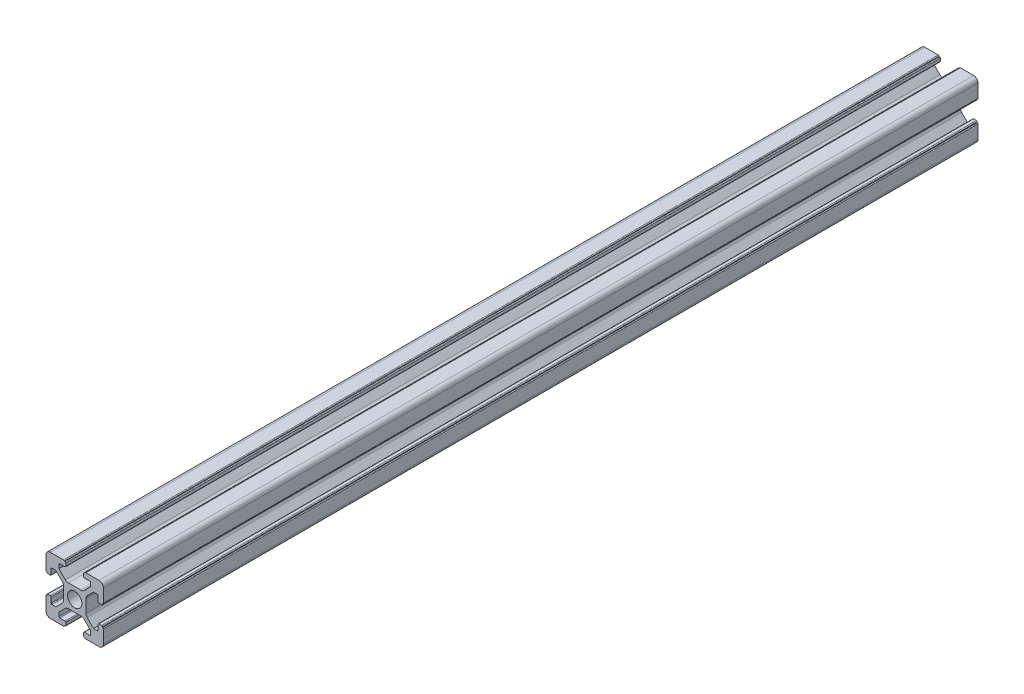
from build123d import *

# Parameters (mm, degrees)
BOSS_EXTRUDE1_DEPTH = 304.8
F_3DSKETCH2_R       = 2.5
CUT_EXTRUDE1_DEPTH  = 306.128019157


with BuildPart() as part:
    # Sketch1 → Boss-Extrude1 (new body)
    with BuildSketch(Plane.XY):
        with BuildLine():
            ThreePointArc((-4.339541497, 3.27832502), (-4.01438237, 2.791689997), (-3.900201668, 2.217664848))
            Line((-3.900201668, 2.217664848), (-3.900201668, -2.220777458))
            ThreePointArc((-3.900201668, -2.220777458), (-4.013982246, -2.793835668), (-4.338062619, -3.279956687))
            ThreePointArc((-4.338062619, -3.279956687), (-4.338801799, -3.280697416), (-4.339541497, -3.28143763))
            Line((-4.339541497, -3.28143763), (-6.559305445, -5.501201578))
            Line((-6.559305445, -5.501201578), (-7.918645273, -5.501201578))
            ThreePointArc((-7.918645273, -5.501201578), (-8.116635172, -5.419191476), (-8.198645273, -5.221201578))
            Line((-8.198645273, -5.221201578), (-8.198645273, -3.381201578))
            ThreePointArc((-8.198645273, -3.381201578), (-8.280655374, -3.183211679), (-8.478645273, -3.101201578))
            Line((-8.478645273, -3.101201578), (-9.418645273, -3.101201578))
            ThreePointArc((-9.418645273, -3.101201578), (-9.616635172, -3.183211679), (-9.698645273, -3.381201578))
            Line((-9.698645273, -3.381201578), (-9.698645273, -3.601201578))
            Line((-9.698645273, -3.601201578), (-9.718645273, -3.601201578))
            ThreePointArc((-9.718645273, -3.601201578), (-9.916635172, -3.683211679), (-9.998645273, -3.881201578))
            Line((-9.998645273, -3.881201578), (-9.998645273, -8.501201578))
            ThreePointArc((-9.998645273, -8.501201578), (-9.559305445, -9.561861749), (-8.498645273, -10.001201578))
            Line((-8.498645273, -10.001201578), (-3.878645273, -10.001201578))
            ThreePointArc((-3.878645273, -10.001201578), (-3.680655374, -9.919191476), (-3.598645273, -9.721201578))
            Line((-3.598645273, -9.721201578), (-3.598645273, -9.701201578))
            Line((-3.598645273, -9.701201578), (-3.378645273, -9.701201578))
            ThreePointArc((-3.378645273, -9.701201578), (-3.180655374, -9.619191476), (-3.098645273, -9.421201578))
            Line((-3.098645273, -9.421201578), (-3.098645273, -8.481201578))
            ThreePointArc((-3.098645273, -8.481201578), (-3.180655374, -8.283211679), (-3.378645273, -8.201201578))
            Line((-3.378645273, -8.201201578), (-5.218645273, -8.201201578))
            ThreePointArc((-5.218645273, -8.201201578), (-5.416635172, -8.119191476), (-5.498645273, -7.921201578))
            Line((-5.498645273, -7.921201578), (-5.498645273, -6.561861749))
            Line((-5.498645273, -6.561861749), (-3.277324929, -4.340541406))
            ThreePointArc((-3.277324929, -4.340541406), (-2.790689906, -4.015382279), (-2.216664757, -3.901201578))
            Line((-2.216664757, -3.901201578), (2.234977304, -3.899793498))
            ThreePointArc((2.234977304, -3.899793498), (2.801097117, -4.016727825), (3.280957809, -4.339061494))
            Line((3.280957809, -4.339061494), (5.502201668, -6.560305354))
            Line((5.502201668, -6.560305354), (5.502201668, -7.919645182))
            ThreePointArc((5.502201668, -7.919645182), (5.420191567, -8.117635081), (5.222201668, -8.199645182))
            Line((5.222201668, -8.199645182), (3.382201668, -8.199645182))
            ThreePointArc((3.382201668, -8.199645182), (3.18421177, -8.281655283), (3.102201668, -8.479645182))
            Line((3.102201668, -8.479645182), (3.102201668, -9.419645182))
            ThreePointArc((3.102201668, -9.419645182), (3.18421177, -9.617635081), (3.382201668, -9.699645182))
            Line((3.382201668, -9.699645182), (3.602201668, -9.699645182))
            Line((3.602201668, -9.699645182), (3.602201668, -9.719645182))
            ThreePointArc((3.602201668, -9.719645182), (3.68421177, -9.917635081), (3.882201668, -9.999645182))
            Line((3.882201668, -9.999645182), (8.502201668, -9.999645182))
            ThreePointArc((8.502201668, -9.999645182), (9.56286184, -9.560305354), (10.002201668, -8.499645182))
            Line((10.002201668, -8.499645182), (10.002201668, -3.879645182))
            ThreePointArc((10.002201668, -3.879645182), (9.920191567, -3.681655283), (9.722201668, -3.599645182))
            Line((9.722201668, -3.599645182), (9.702201668, -3.599645182))
            Line((9.702201668, -3.599645182), (9.702201668, -3.379645182))
            ThreePointArc((9.702201668, -3.379645182), (9.620191567, -3.181655283), (9.422201668, -3.099645182))
            Line((9.422201668, -3.099645182), (8.482201668, -3.099645182))
            ThreePointArc((8.482201668, -3.099645182), (8.28421177, -3.181655283), (8.202201668, -3.379645182))
            Line((8.202201668, -3.379645182), (8.202201668, -5.219645182))
            ThreePointArc((8.202201668, -5.219645182), (8.120191567, -5.417635081), (7.922201668, -5.499645182))
            Line((7.922201668, -5.499645182), (6.56286184, -5.499645182))
            Line((6.56286184, -5.499645182), (4.341541497, -3.278324838))
            ThreePointArc((4.341541497, -3.278324838), (4.01638237, -2.791689815), (3.902201668, -2.217664667))
            Line((3.902201668, -2.217664667), (3.900793589, 2.233977395))
            ThreePointArc((3.900793589, 2.233977395), (4.017727916, 2.800097207), (4.340061585, 3.2799579))
            Line((4.340061585, 3.2799579), (6.561305445, 5.501201759))
            Line((6.561305445, 5.501201759), (7.920645273, 5.501201759))
            ThreePointArc((7.920645273, 5.501201759), (8.118635172, 5.419191658), (8.200645273, 5.221201759))
            Line((8.200645273, 5.221201759), (8.200645273, 3.381201759))
            ThreePointArc((8.200645273, 3.381201759), (8.282655374, 3.183211861), (8.480645273, 3.101201759))
            Line((8.480645273, 3.101201759), (9.420645273, 3.101201759))
            ThreePointArc((9.420645273, 3.101201759), (9.618635172, 3.183211861), (9.700645273, 3.381201759))
            Line((9.700645273, 3.381201759), (9.700645273, 3.601201759))
            Line((9.700645273, 3.601201759), (9.720645273, 3.601201759))
            ThreePointArc((9.720645273, 3.601201759), (9.918635172, 3.683211861), (10.000645273, 3.881201759))
            Line((10.000645273, 3.881201759), (10.000645273, 8.501201759))
            ThreePointArc((10.000645273, 8.501201759), (9.561305445, 9.561861931), (8.500645273, 10.001201759))
            Line((8.500645273, 10.001201759), (3.880645273, 10.001201759))
            ThreePointArc((3.880645273, 10.001201759), (3.682655374, 9.919191658), (3.600645273, 9.721201759))
            Line((3.600645273, 9.721201759), (3.600645273, 9.701201759))
            Line((3.600645273, 9.701201759), (3.380645273, 9.701201759))
            ThreePointArc((3.380645273, 9.701201759), (3.182655374, 9.619191658), (3.100645273, 9.421201759))
            Line((3.100645273, 9.421201759), (3.100645273, 8.481201759))
            ThreePointArc((3.100645273, 8.481201759), (3.182655374, 8.283211861), (3.380645273, 8.201201759))
            Line((3.380645273, 8.201201759), (5.220645273, 8.201201759))
            ThreePointArc((5.220645273, 8.201201759), (5.418635172, 8.119191658), (5.500645273, 7.921201759))
            Line((5.500645273, 7.921201759), (5.500645273, 6.561861931))
            Line((5.500645273, 6.561861931), (3.279324929, 4.340541588))
            ThreePointArc((3.279324929, 4.340541588), (2.792689906, 4.015382461), (2.218664757, 3.901201759))
            Line((2.218664757, 3.901201759), (-2.232977304, 3.89979368))
            ThreePointArc((-2.232977304, 3.89979368), (-2.799097117, 4.016728006), (-3.278957809, 4.339061676))
            Line((-3.278957809, 4.339061676), (-5.500201668, 6.560305535))
            Line((-5.500201668, 6.560305535), (-5.500201668, 7.919645364))
            ThreePointArc((-5.500201668, 7.919645364), (-5.418191567, 8.117635262), (-5.220201668, 8.199645364))
            Line((-5.220201668, 8.199645364), (-3.380201668, 8.199645364))
            ThreePointArc((-3.380201668, 8.199645364), (-3.18221177, 8.281655465), (-3.100201668, 8.479645364))
            Line((-3.100201668, 8.479645364), (-3.100201668, 9.419645364))
            ThreePointArc((-3.100201668, 9.419645364), (-3.18221177, 9.617635262), (-3.380201668, 9.699645364))
            Line((-3.380201668, 9.699645364), (-3.600201668, 9.699645364))
            Line((-3.600201668, 9.699645364), (-3.600201668, 9.719645364))
            ThreePointArc((-3.600201668, 9.719645364), (-3.68221177, 9.917635262), (-3.880201668, 9.999645364))
            Line((-3.880201668, 9.999645364), (-8.500201668, 9.999645364))
            ThreePointArc((-8.500201668, 9.999645364), (-9.56086184, 9.560305535), (-10.000201668, 8.499645364))
            Line((-10.000201668, 8.499645364), (-10.000201668, 3.879645364))
            ThreePointArc((-10.000201668, 3.879645364), (-9.918191567, 3.681655465), (-9.720201668, 3.599645364))
            Line((-9.720201668, 3.599645364), (-9.700201668, 3.599645364))
            Line((-9.700201668, 3.599645364), (-9.700201668, 3.379645364))
            ThreePointArc((-9.700201668, 3.379645364), (-9.618191567, 3.181655465), (-9.420201668, 3.099645364))
            Line((-9.420201668, 3.099645364), (-8.480201668, 3.099645364))
            ThreePointArc((-8.480201668, 3.099645364), (-8.28221177, 3.181655465), (-8.200201668, 3.379645364))
            Line((-8.200201668, 3.379645364), (-8.200201668, 5.219645364))
            ThreePointArc((-8.200201668, 5.219645364), (-8.118191567, 5.417635262), (-7.920201668, 5.499645364))
            Line((-7.920201668, 5.499645364), (-6.56086184, 5.499645364))
            Line((-6.56086184, 5.499645364), (-4.339541497, 3.27832502))
        make_face()
    extrude(amount=BOSS_EXTRUDE1_DEPTH)

    # 3DSketch2 → Cut-Extrude1 (cut, through all)
    with BuildSketch(Plane.XY):
        Circle(F_3DSKETCH2_R)
    extrude(amount=CUT_EXTRUDE1_DEPTH, mode=Mode.SUBTRACT)


solid = part.part
